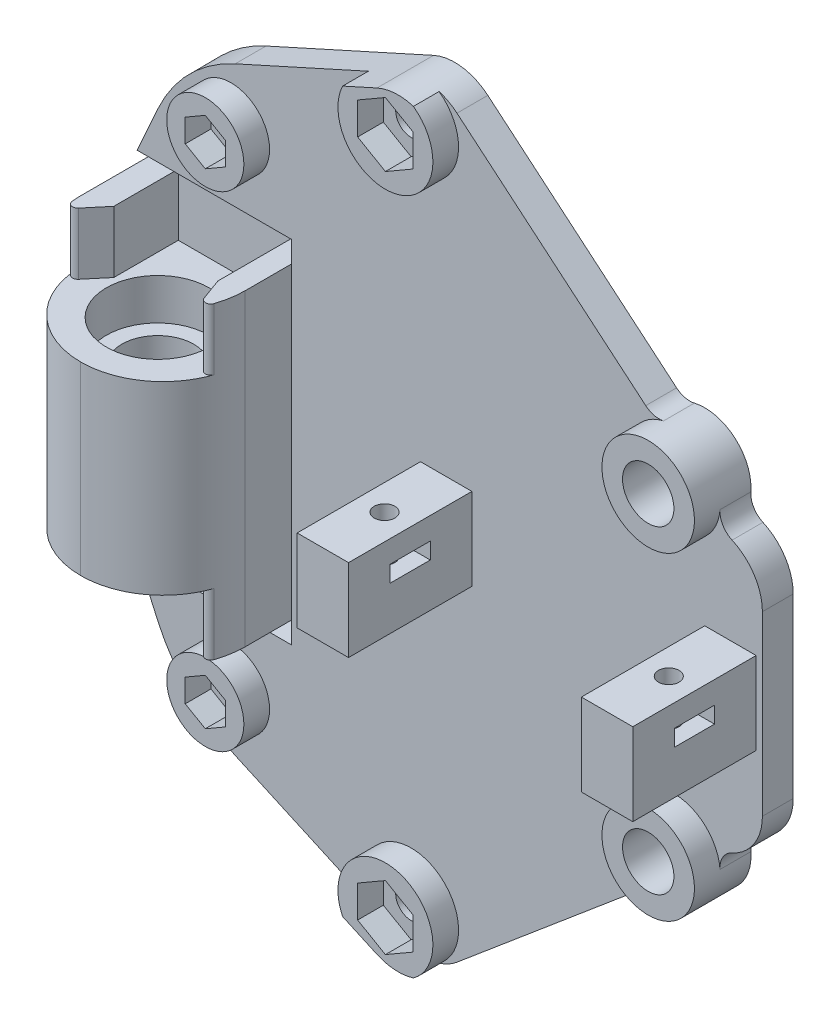
from build123d import *

# Parameters (mm, degrees)
CROQUIS3_R                = 2.5000000000000027
CROQUIS3_R_2              = 1.5000000000000009
CROQUIS3_R_3              = 0.9999999999999983
CROQUIS3_R_4              = 2.5000000000000013
SALIENTE_EXTRUIR1_DEPTH   = 3
SALIENTE_EXTRUIR2_DEPTH   = 12
CROQUIS6_R                = 1.0000000000000013
CROQUIS6_R_2              = 1.0000000000000002
CORTAR_EXTRUIR1_DEPTH     = 7
SALIENTE_EXTRUIR4_START   = 2.5
CROQUIS10_R               = 3.751666049839528
CROQUIS10_R_2             = 4.499999999999995
CROQUIS10_R_3             = 2.5000000000000036
SALIENTE_EXTRUIR4_DEPTH   = 2.5
REDONDEO4_R               = 15
REDONDEO5_R               = 5
SALIENTE_EXTRUIR6_START   = 2.5
SALIENTE_EXTRUIR6_DEPTH   = 2.5
CORTAR_EXTRUIR5_START     = -2.5
CORTAR_EXTRUIR5_DEPTH     = 2.5
CROQUIS16_W               = 16
CROQUIS16_H               = 17.999999999999993
SALIENTE_EXTRUIR7_DEPTH   = 15
CROQUIS8_R                = 4.999999999999997
CORTAR_EXTRUIR2_DEPTH     = 4
CORTAR_EXTRUIR3_START     = -14
CROQUIS8_2_R              = 4.999999999999997
CORTAR_EXTRUIR3_DEPTH     = 4
CROQUIS12_R               = 3.5000000000000004
CORTAR_EXTRUIR4_DEPTH     = 10
REDONDEO6_R               = 8
SALIENTE_EXTRUIR8_DEPTH   = 6
REDONDEO10_R              = 0.5
REDONDEO10_OF_SIMETR_A3_R = 0.5
CORTAR_EXTRUIR6_DEPTH     = 32.65


with BuildPart() as part:
    # Croquis3 → Saliente-Extruir1 (new body)
    with BuildSketch(Plane.XY):
        with BuildLine():
            Line((-6.94786223448668, 41.342536860149195), (-27.71873339137468, 58.82836217622058))
            Line((-27.71873339137468, 58.82836217622058), (-52.06950472778811, 47.82825147485582))
            Line((-52.06950472778811, 47.82825147485582), (-64.06880280185534, 21.036604802480003))
            Line((-64.06880280185534, 21.036604802480003), (-52.0695047277881, -5.755041869895824))
            Line((-52.0695047277881, -5.755041869895824), (-27.718733391374666, -16.755152571260584))
            Line((-27.718733391374666, -16.755152571260584), (-6.947862234486694, 0.73067274481082))
            ThreePointArc((-6.947862234486694, 0.73067274481082), (-6.129978476714667, 1.1446067487189793), (-5.213330138508751, 1.150176747198823))
            ThreePointArc((-5.213330138508751, 1.150176747198823), (-1.2709443219397119, 2.127867121954703), (0.2779498979146519, 5.882758743729784))
            ThreePointArc((0.2779498979146519, 5.882758743729784), (0.8044251875525397, 7.395337338549455), (2.2720239589632287, 8.036604897575938))
            Line((2.2720239589632287, 8.036604897575938), (4.399490704258791, 8.036604897575932))
            Line((4.399490704258791, 8.036604897575932), (4.399490704258796, 34.036604707384065))
            Line((4.399490704258796, 34.036604707384065), (2.272023958963246, 34.036604707384065))
            ThreePointArc((2.272023958963246, 34.036604707384065), (0.8044251875525599, 34.67787226641055), (0.27794989791467706, 36.190450861230225))
            ThreePointArc((0.27794989791467706, 36.190450861230225), (-1.2709443219396896, 39.94534248300532), (-5.213330138508737, 40.923032857761186))
            ThreePointArc((-5.213330138508737, 40.923032857761186), (-6.129978476714655, 40.92860285624103), (-6.94786223448668, 41.342536860149195))
        make_face()
        with Locations((-4.208716739444608, 36.53660470738407)):
            Circle(CROQUIS3_R, mode=Mode.SUBTRACT)
        with Locations((-29.772203367298626, 54.02119886988243)):
            Circle(CROQUIS3_R_2, mode=Mode.SUBTRACT)
        with Locations((-47.293421876680526, 44.62288950996411)):
            Circle(CROQUIS3_R_3, mode=Mode.SUBTRACT)
        with Locations(Location((-4.208716739444621, 5.536604897575941, 0), (0, 0, 180))):
            Circle(CROQUIS3_R_4, mode=Mode.SUBTRACT)
        with Locations(Location((-47.29342187668052, -2.5496799050041195, 0), (0, 0, 180))):
            Circle(CROQUIS3_R_3, mode=Mode.SUBTRACT)
        with Locations(Location((-29.77220336729862, -11.947989264922445, 0), (0, 0, 180))):
            Circle(CROQUIS3_R_2, mode=Mode.SUBTRACT)
    extrude(amount=-SALIENTE_EXTRUIR1_DEPTH)

    # Croquis5 → Saliente-Extruir2 (add)
    with BuildSketch(Plane.XY):
        Polygon((-28.858716739444507, 25.66160480247996), (-23.858716739444503, 25.661604802479957), (-23.858716739444503, 17.66160480247996), (-28.858716739444507, 17.66160480247996), align=None)
        Polygon((3.7912832605554865, 17.661604802479964), (3.7912832605554794, 25.661604802479964), (-1.208716739444518, 25.66160480247996), (-1.2087167394445146, 17.661604802479964), align=None)
    extrude(amount=SALIENTE_EXTRUIR2_DEPTH)

    # Croquis6 → Cortar-Extruir1 (cut)
    with BuildSketch(Plane(origin=(1.781e-14, 25.661604802479943, 0), x_dir=(1, 6.9e-16, 0), z_dir=(-6.9e-16, 1, 0))):
        with Locations(Location((-26.358716739444525, -6, 0), (0, 0, 180))):
            Circle(CROQUIS6_R)
        with Locations((1.2912832605554667, -6)):
            Circle(CROQUIS6_R_2)
    extrude(amount=-CORTAR_EXTRUIR1_DEPTH, mode=Mode.SUBTRACT)

    # Croquis10 → Saliente-Extruir4 (add)
    # profile 1 of 3: a face of its own
    with BuildSketch(Plane.XY.offset(SALIENTE_EXTRUIR4_START)):
        with Locations((-47.293421876680526, 44.62288950996411)):
            Circle(CROQUIS10_R)
        Polygon((-47.29342187668054, 42.37122346012457), (-45.34342187668052, 43.49705648504435), (-45.34342187668053, 45.74872253488385), (-47.29342187668053, 46.87455555980363), (-49.24342187668053, 45.748722534883875), (-49.24342187668052, 43.49705648504435), align=None, mode=Mode.SUBTRACT)
    # profile 2 of 3: a face of its own
    with BuildSketch(Plane.XY.offset(SALIENTE_EXTRUIR4_START)):
        with Locations((-4.208716739444608, 36.53660470738407)):
            Circle(CROQUIS10_R_2)
        with Locations((-4.208716739444608, 36.53660470738407)):
            Circle(CROQUIS10_R_3, mode=Mode.SUBTRACT)
    # profile 3 of 3: a face of its own
    with BuildSketch(Plane.XY.offset(SALIENTE_EXTRUIR4_START)):
        with BuildLine():
            Line((-28.520730934773418, 58.46607132153967), (-33.93469022724589, 56.020393082968894))
            ThreePointArc((-33.93469022724589, 56.020393082968894), (-27.871193961530338, 49.81296437070674), (-28.520730934773418, 58.46607132153967))
        make_face()
        Polygon((-29.772203367298623, 50.90350741625844), (-27.072203367298624, 52.46235314307043), (-27.072203367298616, 55.580044596694414), (-29.772203367298612, 57.138890323506416), (-32.47220336729861, 55.58004459669444), (-32.472203367298626, 52.462353143070445), align=None, mode=Mode.SUBTRACT)
    saliente_extruir4 = extrude(amount=-SALIENTE_EXTRUIR4_DEPTH)

    # Simetría2: Saliente-Extruir4 across plane
    add(saliente_extruir4.mirror(Plane(origin=(0, 21.036604802479996, 0), x_dir=(0, 0, 1), z_dir=(0, -1, 0))))

    # Redondeo4
    redondeo4_edges = [part.edges().sort_by_distance(p)[0] for p in [
        (-52.0695047277881, -5.755041869895824, -1.5),
        (-64.06880280185534, 21.036604802480003, -1.5),
        (-52.06950472778811, 47.82825147485582, -1.5),
    ]]
    fillet(redondeo4_edges, radius=REDONDEO4_R)

    # Redondeo5
    redondeo5_edges = [part.edges().sort_by_distance(p)[0] for p in [
        (4.399490704258796, 34.036604707384065, -1.5),
        (-27.71873339137468, 58.82836217622058, -1.5),
        (-27.718733391374666, -16.755152571260584, -1.5),
        (4.399490704258791, 8.036604897575932, -1.5),
    ]]
    fillet(redondeo5_edges, radius=REDONDEO5_R)

    # Croquis14 → Saliente-Extruir6 (add)
    with BuildSketch(Plane(origin=(0, 0, -3), x_dir=(-1, 0, 0), z_dir=(0, 0, -1)).offset(SALIENTE_EXTRUIR6_START)):
        with BuildLine():
            Line((53.01830981876134, -2.997250029738774), (51.6513077567385, 0.02886082366314671))
            ThreePointArc((51.6513077567385, 0.02886082366314671), (50.49127760877796, 1.092543010289408), (48.92090073776822, 0.9876324706806112))
            ThreePointArc((48.92090073776822, 0.9876324706806112), (16.2087162792061, 21.03660473613081), (48.9209007518344, 41.085576978630414))
            ThreePointArc((48.9209007518344, 41.085576978630414), (50.49127762343251, 40.98066643815229), (51.65130777205501, 42.044348625011))
            Line((51.65130777205501, 42.044348625011), (53.01830987086137, 45.070459559840025))
            ThreePointArc((53.01830987086137, 45.070459559840025), (53.764302238120166, 43.88397994729048), (54.39630163909832, 42.633054194031175))
            Line((54.39630163909832, 42.633054194031175), (61.322765277499, 27.1678690353972))
            ThreePointArc((61.322765277499, 27.1678690353972), (62.63307576655135, 21.036604802480014), (61.32276527749901, 14.905340569562824))
            Line((61.32276527749901, 14.905340569562824), (54.396301639098304, -0.5598445890711984))
            ThreePointArc((54.396301639098304, -0.5598445890711984), (53.76430221567721, -1.8107703820277914), (53.01830981876134, -2.997250029738774))
        make_face()
    extrude(amount=-SALIENTE_EXTRUIR6_DEPTH)

    # Croquis15 → Cortar-Extruir5 (cut)
    with BuildSketch(Plane.XY.offset(CORTAR_EXTRUIR5_START)):
        with BuildLine():
            Line((-61.32276527749901, 14.905340569562824), (-56.41775389116526, 3.9535889608046952))
            Line((-56.41775389116526, 3.9535889608046952), (-41.417753891165255, 3.953588960804696))
            Line((-41.417753891165255, 3.953588960804696), (-41.417753891165255, 38.119620644155326))
            Line((-41.417753891165255, 38.119620644155326), (-56.41775389116526, 38.11962064415533))
            Line((-56.41775389116526, 38.11962064415533), (-61.32276527749901, 27.167869035397203))
            ThreePointArc((-61.32276527749901, 27.167869035397203), (-62.63307576655134, 21.036604802480017), (-61.32276527749901, 14.905340569562824))
        make_face()
    extrude(amount=CORTAR_EXTRUIR5_DEPTH, mode=Mode.SUBTRACT)

    # Croquis16 → Saliente-Extruir7 (add)
    with BuildSketch(Plane.XY.offset(-2.5)):
        with Locations((-49.41775389116526, 21.03660480248001)):
            Rectangle(CROQUIS16_W, CROQUIS16_H)
    extrude(amount=SALIENTE_EXTRUIR7_DEPTH)

    # Croquis8 → Cortar-Extruir2 (cut)
    with BuildSketch(Plane.XZ.offset(-12.036604802480012)):
        with Locations(Location((-49.41775389116526, 4.999999999999999, 0), (0, 0, 270))):
            Circle(CROQUIS8_R)
    extrude(amount=-CORTAR_EXTRUIR2_DEPTH, mode=Mode.SUBTRACT)

    # Croquis8<2> → Cortar-Extruir3 (cut)
    with BuildSketch(Plane.XZ.offset(-12.036604802480012).offset(CORTAR_EXTRUIR3_START)):
        with Locations(Location((-49.41775389116526, 4.999999999999999, 0), (0, 0, 270))):
            Circle(CROQUIS8_2_R)
    extrude(amount=-CORTAR_EXTRUIR3_DEPTH, mode=Mode.SUBTRACT)

    # Croquis12 → Cortar-Extruir4 (cut)
    with BuildSketch(Plane.XZ.offset(-16.036604802480014)):
        with Locations(Location((-49.41775389116526, 4.999999999999999, 0), (0, 0, 270))):
            Circle(CROQUIS12_R)
    extrude(amount=-CORTAR_EXTRUIR4_DEPTH, mode=Mode.SUBTRACT)

    # Redondeo6
    redondeo6_edges = [part.edges().sort_by_distance(p)[0] for p in [
        (-41.41775389116526, 21.03660480248001, 12.5),
        (-57.41775389116526, 21.036604802480007, 12.5),
    ]]
    fillet(redondeo6_edges, radius=REDONDEO6_R - 0.0001)  # a hair under: the kernel refuses the full size

    # Croquis17 → Saliente-Extruir8 (add)
    with BuildSketch(Plane.XZ.offset(-12.036604802480012)):
        with BuildLine():
            Line((-54.91775389116526, 3.776025624966147), (-54.91775389116526, -2.5000000000000004))
            Line((-54.91775389116526, -2.5000000000000004), (-57.41775389116526, -2.5))
            Line((-57.41775389116526, -2.5), (-57.41775389116526, 4.499999999999943))
            ThreePointArc((-57.41775389116526, 4.499999999999943), (-57.356328969145196, 5.489457291284446), (-57.17299745834626, 6.463720248329115))
            Line((-57.17299745834626, 6.463720248329115), (-54.91775389116526, 3.776025624966147))
        make_face()
        with BuildLine():
            Line((-41.41775389116526, 4.499999999999999), (-41.417753891165255, -2.5))
            Line((-41.417753891165255, -2.5), (-43.56477614254775, -2.5000000000000004))
            Line((-43.56477614254775, -2.5000000000000004), (-43.56477614254775, 5.000000000000022))
            Line((-43.56477614254775, 5.000000000000022), (-42.3693995452198, 8.284270208903127))
            ThreePointArc((-42.3693995452198, 8.284270208903127), (-41.65931220589225, 6.451046543836961), (-41.41775389116526, 4.499999999999999))
        make_face()
    saliente_extruir8 = extrude(amount=SALIENTE_EXTRUIR8_DEPTH)

    # Redondeo10
    redondeo10_edges = [part.edges().sort_by_distance(p)[0] for p in [
        (-57.17299745834626, 9.036604802480012, 6.463720248329115),
        (-42.3693995452198, 9.036604802480012, 8.284270208903127),
    ]]
    fillet(redondeo10_edges, radius=REDONDEO10_R)

    # Simetría3: Saliente-Extruir8 across plane
    add(saliente_extruir8.mirror(Plane(origin=(0, 21.036604802479996, 0), x_dir=(0, 0, 1), z_dir=(0, -1, 0))))

    # Redondeo10 of Simetría3
    redondeo10_of_simetr_a3_edges = [part.edges().sort_by_distance(p)[0] for p in [
        (-57.17299745834626, 33.03660480247998, 6.463720248329115),
        (-42.3693995452198, 33.03660480247998, 8.284270208903127),
    ]]
    fillet(redondeo10_of_simetr_a3_edges, radius=REDONDEO10_OF_SIMETR_A3_R)

    # Croquis18 → Cortar-Extruir6 (cut)
    with BuildSketch(Plane.ZY.offset(28.858716739444507)):
        Polygon((7.95, 23.505763168486737), (4.05, 23.505763168486737), (4.049999999999998, 21.905763168486736), (7.950000000000002, 21.905763168486736), align=None)
    extrude(amount=-CORTAR_EXTRUIR6_DEPTH, mode=Mode.SUBTRACT)


solid = part.part
